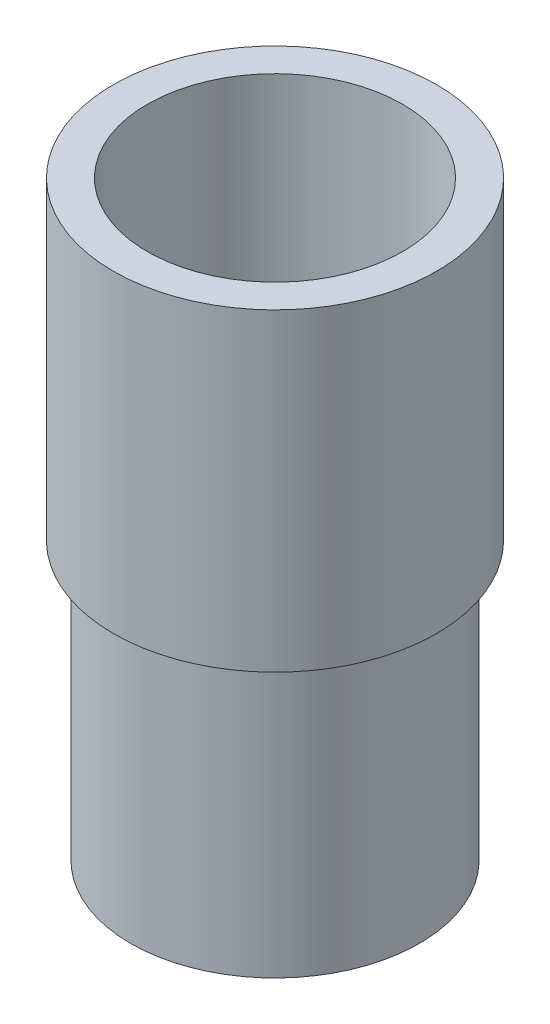
from build123d import *


with BuildPart() as part:
    # Sketch1 → Revolve1 (revolve)
    with BuildSketch(Plane.XY):
        Polygon((14.0462, 30.48), (14.0462, 0), (15.875, 0), (15.875, 30.48), (17.78, 30.48), (17.78, 65), (14.0462, 65), (14.0462, 40.48), (0, 40.48), (0, 30.48), align=None)
    revolve(axis=Axis((0, 0, 0), (0, 1, 0)))


solid = part.part
